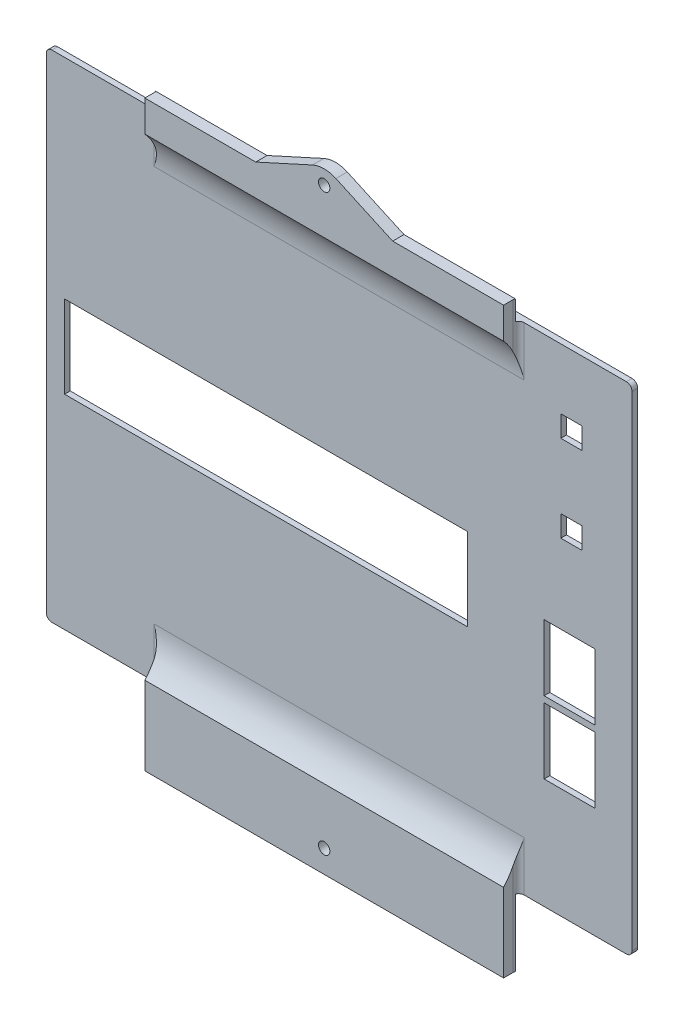
from build123d import *

# Parameters (mm, degrees)
SKETCH2_W           = 103.235
SKETCH2_H           = 87.36
SKETCH2_W_2         = 9
SKETCH2_H_2         = 11.625667
SKETCH2_W_3         = 3.751667
SKETCH2_H_3         = 3.751667
SKETCH2_W_4         = 71.061666
SKETCH2_H_4         = 14.546666
BOSS_EXTRUDE1_DEPTH = 1
BOSS_EXTRUDE2_START = -20
BOSS_EXTRUDE2_DEPTH = 63.235
FILLET1_R           = 10
FILLET2_R           = 1
FILLET4_R           = 1
BOSS_EXTRUDE3_DEPTH = 2
SKETCH5_R           = 1
CUT_EXTRUDE1_DEPTH  = 150.95559423


with BuildPart() as part:
    # Sketch2 → Boss-Extrude1 (new body)
    with BuildSketch(Plane.XY):
        with Locations((-77.235921563, -21.097735573)):
            Rectangle(SKETCH2_W, SKETCH2_H)
        with Locations((-36.618421563, -39.491569073)):
            Rectangle(SKETCH2_W_2, SKETCH2_H_2, mode=Mode.SUBTRACT)
        with Locations((-36.618421563, -26.791569073)):
            Rectangle(SKETCH2_W_2, SKETCH2_H_2, mode=Mode.SUBTRACT)
        with Locations((-36.299588063, -5.201569073)):
            Rectangle(SKETCH2_W_3, SKETCH2_H_3, mode=Mode.SUBTRACT)
        with Locations((-36.299588063, 10.038430927)):
            Rectangle(SKETCH2_W_3, SKETCH2_H_3, mode=Mode.SUBTRACT)
        with Locations((-90.105254563, -21.563402573)):
            Rectangle(SKETCH2_W_4, SKETCH2_H_4, mode=Mode.SUBTRACT)
    extrude(amount=BOSS_EXTRUDE1_DEPTH)

    # Sketch4 → Boss-Extrude2 (add)
    with BuildSketch(Plane.ZY.offset(128.853421563).offset(BOSS_EXTRUDE2_START)):
        Polygon((1.64, 23.082264427), (1.64, 26.082264427), (3.64, 26.082264427), (3.64, 20.582264427), (1, 20.582264427), (1, 22.582264427), (1.64, 22.582264427), align=None)
        Polygon((1.64, -76.617402573), (1.64, -73.617402573), (1.64, -64.777735573), (1, -64.777735573), (1, -62.777735573), (3.64, -62.777735573), (3.64, -76.617402573), align=None)
    extrude(amount=-BOSS_EXTRUDE2_DEPTH)

    # Fillet1
    # the kernel refuses this fillet: 10 mm, written as the material it adds along each edge
    with BuildSketch(Plane(origin=(-108.853421563, -62.777735573, 1), x_dir=(0, 1, 0), z_dir=(1, 0, 0))) as fillet1_piece_1:
        with BuildLine():
            CenterArc((6.769815359, 10), FILLET1_R, 227.39178247, 42.60821753)
            Line((0, 2.64), (-0.135396307, 2.4928))
            ThreePointArc((-0.135396307, 2.4928), (-0.2, 1.32), (-0.2, 0))
            Line((-0.2, 0), (0, -0.2))
            Line((0, -0.2), (6.769815359, -0.2))
            Line((6.769815359, -0.2), (6.769815359, 0))
        make_face()
    extrude(amount=63.235)
    with BuildSketch(Plane(origin=(-108.853421563, 20.582264427, 1), x_dir=(0, -1, 0), z_dir=(1, 0, 0))) as fillet1_piece_2:
        with BuildLine():
            CenterArc((6.769815359, -10), FILLET1_R, 90, 42.60821753)
            Line((0, -2.64), (-0.135396307, -2.4928))
            ThreePointArc((-0.135396307, -2.4928), (-0.2, -1.32), (-0.2, 0))
            Line((-0.2, 0), (0, 0.2))
            Line((0, 0.2), (6.769815359, 0.2))
            Line((6.769815359, 0.2), (6.769815359, 0))
        make_face()
    extrude(amount=63.235)

    # Fillet2
    fillet2_edges = [part.edges().sort_by_distance(p)[0] for p in [
        (-128.853421563, 22.582264427, 0.5),
        (-128.853421563, -64.777735573, 0.5),
        (-25.618421563, -64.777735573, 0.5),
        (-25.618421563, 22.582264427, 0.5),
    ]]
    fillet(fillet2_edges, radius=FILLET2_R)

    # Fillet4
    fillet4_edges = [part.edges().sort_by_distance(p)[0] for p in [
        (-45.618421563, -60.392827893, 1),
    ]]
    fillet(fillet4_edges, radius=FILLET4_R)
    fillet4_2_edges = [part.edges().sort_by_distance(p)[0] for p in [
        (-108.853421563, -60.392827893, 1),
    ]]
    fillet(fillet4_2_edges, radius=FILLET4_R)
    fillet4_3_edges = [part.edges().sort_by_distance(p)[0] for p in [
        (-45.618421563, 18.197356748, 1),
    ]]
    fillet(fillet4_3_edges, radius=FILLET4_R)
    fillet4_4_edges = [part.edges().sort_by_distance(p)[0] for p in [
        (-108.853421563, 18.197356748, 1),
    ]]
    fillet(fillet4_4_edges, radius=FILLET4_R)

    # Sketch6 → Boss-Extrude3 (add)
    with BuildSketch(Plane.XY.offset(3.64)):
        with BuildLine():
            Line((-89.306989375, 26.082264427), (-79.306989375, 30.633163033))
            ThreePointArc((-79.306989375, 30.633163033), (-77.235921563, 31.082264427), (-75.164853752, 30.633163033))
            Line((-75.164853752, 30.633163033), (-65.164853752, 26.082264427))
            Line((-65.164853752, 26.082264427), (-89.306989375, 26.082264427))
        make_face()
    extrude(amount=-BOSS_EXTRUDE3_DEPTH)

    # Sketch5 → Cut-Extrude1 (cut, through all)
    with BuildSketch(Plane.XY.offset(3.64)):
        with Locations((-77.235921563, -72.617402573)):
            Circle(SKETCH5_R)
        with Locations((-77.235921563, 28.582264427)):
            Circle(SKETCH5_R)
    extrude(amount=-CUT_EXTRUDE1_DEPTH, mode=Mode.SUBTRACT)


solid = part.part
